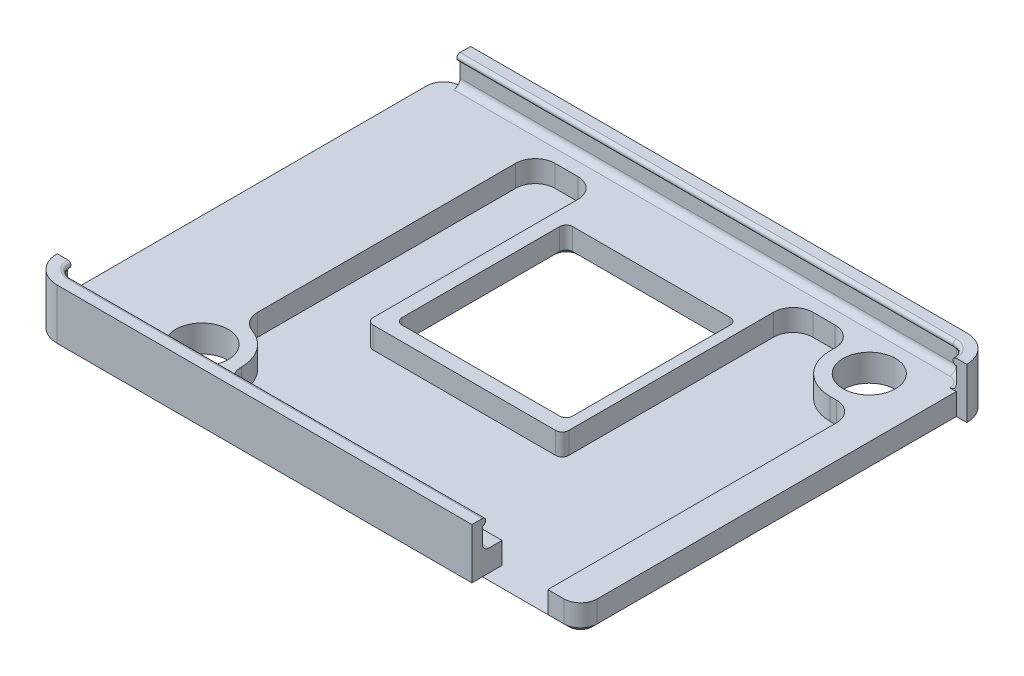
from build123d import *

# Parameters (mm, degrees)
CROQUIS1_W              = 40.35
CROQUIS1_H              = 29.9
CROQUIS1_R              = 2
SALIENTE_EXTRUIR1_DEPTH = 2.05
CORTAR_EXTRUIR2_DEPTH   = 1.65
CROQUIS3_W              = 13
CROQUIS3_H              = 13
CORTAR_EXTRUIR3_DEPTH   = 47.737063506
REDONDEO2_R             = 0.5
CHAFL_N1_SIZE           = 0.4
REDONDEO4_R             = 1.27
SALIENTE_EXTRUIR3_START = -2.05
SALIENTE_EXTRUIR3_DEPTH = 4.25
SALIENTE_EXTRUIR4_DEPTH = 1.65
CROQUIS9_R              = 0.25
CROQUIS11_R             = 0.25
REDONDEO6_R             = 1.5
REDONDEO7_R             = 0.5
REDONDEO8_R             = 0.5
CHAFL_N2_SIZE           = 0.4


# Some blends are built 0.0001 mm under size
with BuildPart() as part:
    # Croquis1 → Saliente-Extruir1 (new body)
    with BuildSketch(Plane(origin=(0, 0, 0), x_dir=(1, 0, 0), z_dir=(0, 1, 0))):
        with Locations((14.905897563, 15.863653327)):
            Rectangle(CROQUIS1_W, CROQUIS1_H)
        with Locations(Location((3.230897563, 3.913653327, 0), (0, 0, 270))):
            Circle(CROQUIS1_R, mode=Mode.SUBTRACT)
        with Locations(Location((30.580897563, 27.413653327, 0), (0, 0, 270))):
            Circle(CROQUIS1_R, mode=Mode.SUBTRACT)
    extrude(amount=SALIENTE_EXTRUIR1_DEPTH)

    # Croquis2 → Cortar-Extruir2 (cut)
    with BuildSketch(Plane(origin=(0, 2.05, 0), x_dir=(1, 0, 0), z_dir=(0, 1, 0))):
        with BuildLine():
            Line((27.580897563, 27.413653327), (27.580897563, 29.313653327))
            Line((27.580897563, 29.313653327), (22.880897563, 29.313653327))
            Line((22.880897563, 29.313653327), (22.880897563, 26.613653327))
            Line((22.880897563, 26.613653327), (22.880897563, 11.713653327))
            Line((22.880897563, 11.713653327), (7.980897563, 11.713653327))
            Line((7.980897563, 11.713653327), (7.980897563, 26.613653327))
            Line((7.980897563, 26.613653327), (7.980897563, 29.313653327))
            Line((7.980897563, 29.313653327), (3.230897563, 29.313653327))
            Line((3.230897563, 29.313653327), (3.230897563, 2.413653327))
            Line((3.230897563, 2.413653327), (27.6, 2.413653327))
            Line((27.6, 2.413653327), (27.6, 0.913653327))
            Line((27.6, 0.913653327), (32.580897563, 0.913653327))
            Line((32.580897563, 0.913653327), (32.580897563, 24.413653327))
            Line((32.580897563, 24.413653327), (30.580897563, 24.413653327))
            ThreePointArc((30.580897563, 24.413653327), (28.459577219, 25.292332983), (27.580897563, 27.413653327))
        make_face()
    extrude(amount=-CORTAR_EXTRUIR2_DEPTH, mode=Mode.SUBTRACT)

    # Croquis3 → Cortar-Extruir3 (cut, through all)
    with BuildSketch(Plane(origin=(0, 2.05, 0), x_dir=(1, 0, 0), z_dir=(0, 1, 0))):
        with Locations((15.580897563, 19.313653327)):
            Rectangle(CROQUIS3_W, CROQUIS3_H)
    extrude(amount=-CORTAR_EXTRUIR3_DEPTH, mode=Mode.SUBTRACT)

    # Redondeo2
    redondeo2_edges = [part.edges().sort_by_distance(p)[0] for p in [
        (9.080897563, 1.025, -12.813653327),
        (9.080897563, 1.025, -25.813653327),
        (22.080897563, 1.025, -25.813653327),
        (22.080897563, 1.025, -12.813653327),
    ]]
    fillet(redondeo2_edges, radius=REDONDEO2_R)

    # Chaflán1
    chafl_n1_edges = [part.edges().sort_by_distance(p)[0] for p in [
        (15.580897563, 0, -25.813653327),
        (22.080897563, 0, -19.313653327),
        (15.580897563, 0, -12.813653327),
        (9.080897563, 0, -19.313653327),
        (21.934450953, 0, -25.667206717),
        (21.934450953, 0, -12.960099936),
        (9.227344172, 0, -12.960099936),
        (9.227344172, 0, -25.667206717),
    ]]
    chamfer(chafl_n1_edges, length=CHAFL_N1_SIZE)

    # Redondeo4
    redondeo4_edges = [part.edges().sort_by_distance(p)[0] for p in [
        (-5.269102437, 1.025, -30.813653327),
        (35.080897563, 1.025, -30.813653327),
        (35.080897563, 1.025, -0.913653327),
        (-5.269102437, 1.025, -0.913653327),
    ]]
    fillet(redondeo4_edges, radius=REDONDEO4_R)

    # Croquis6 → Saliente-Extruir3 (add)
    with BuildSketch(Plane(origin=(0, 2.05, 0), x_dir=(1, 0, 0), z_dir=(0, 1, 0)).offset(SALIENTE_EXTRUIR3_START)):
        with BuildLine():
            Line((-3.999102437, 30.813653327), (33.810897563, 30.813653327))
            ThreePointArc((33.810897563, 30.813653327), (34.708923175, 30.441678939), (35.080897563, 29.543653327))
            Line((35.080897563, 29.543653327), (35.880897563, 29.543653327))
            ThreePointArc((35.880897563, 29.543653327), (35.2746086, 31.007364364), (33.810897563, 31.613653327))
            Line((33.810897563, 31.613653327), (-3.999102437, 31.613653327))
            Line((-3.999102437, 31.613653327), (-3.999102437, 30.813653327))
        make_face()
        with BuildLine():
            Line((27.6, 0.913653327), (-3.999102437, 0.913653327))
            ThreePointArc((-3.999102437, 0.913653327), (-4.89712805, 1.285627715), (-5.269102437, 2.183653327))
            Line((-5.269102437, 2.183653327), (-6.069102437, 2.183653327))
            ThreePointArc((-6.069102437, 2.183653327), (-5.462813475, 0.71994229), (-3.999102437, 0.113653327))
            Line((-3.999102437, 0.113653327), (27.6, 0.113653327))
            Line((27.6, 0.113653327), (27.6, 0.913653327))
        make_face()
    extrude(amount=SALIENTE_EXTRUIR3_DEPTH)

    # Croquis7 → Saliente-Extruir4 (add)
    with BuildSketch(Plane(origin=(0, 0.4, 0), x_dir=(1, 0, 0), z_dir=(0, 1, 0))):
        with BuildLine():
            ThreePointArc((6.230897563, 3.913653327), (5.352217906, 6.03497367), (3.230897563, 6.913653327))
            Line((3.230897563, 6.913653327), (3.230897563, 5.913653327))
            ThreePointArc((3.230897563, 5.913653327), (5.101726256, 4.620760108), (4.553773218, 2.413653327))
            Line((4.553773218, 2.413653327), (6.230897563, 2.413653327))
            Line((6.230897563, 2.413653327), (6.230897563, 3.913653327))
        make_face()
    extrude(amount=SALIENTE_EXTRUIR4_DEPTH)

    # Barrer1: sweep along a path in Croquis10
    with BuildLine(Plane(origin=(0, 4.25, 0), x_dir=(1, 0, 0), z_dir=(0, 1, 0))) as barrer1_path:
        Line((-3.999102437, 30.813653327), (33.810897563, 30.813653327))
        ThreePointArc((33.810897563, 30.813653327), (34.708923175, 30.441678939), (35.080897563, 29.543653327))
    # Croquis9 → Barrer1 (sweep)
    with BuildSketch(Plane.XY.offset(-29.543653327)):
        with Locations((35.080897563, 4)):
            Circle(CROQUIS9_R)
    sweep(path=barrer1_path.line)

    # Barrer2: sweep along a path in Croquis12
    with BuildLine(Plane(origin=(0, 4.25, 0), x_dir=(1, 0, 0), z_dir=(0, 1, 0))) as barrer2_path:
        Line((27.6, 0.913653327), (-3.999102437, 0.913653327))
        ThreePointArc((-3.999102437, 0.913653327), (-4.89712805, 1.285627715), (-5.269102437, 2.183653327))
    # Croquis11 → Barrer2 (sweep)
    with BuildSketch(Plane(origin=(0, 0, -2.183653327), x_dir=(-1, 0, 0), z_dir=(0, 0, -1))):
        with Locations((5.269102437, 4)):
            Circle(CROQUIS11_R)
    sweep(path=barrer2_path.line)

    # Redondeo6
    redondeo6_edges = [part.edges().sort_by_distance(p)[0] for p in [
        (3.230897563, 1.225, -6.913653327),
        (6.230897563, 1.225, -2.413653327),
        (3.230897563, 1.225, -29.313653327),
        (7.980897563, 1.225, -29.313653327),
        (22.880897563, 1.225, -29.313653327),
        (27.580897563, 1.225, -29.313653327),
        (32.580897563, 1.225, -24.413653327),
    ]]
    fillet(redondeo6_edges, radius=REDONDEO6_R - 0.0001)  # a hair under: the kernel refuses the full size

    # Redondeo7
    redondeo7_edges = [part.edges().sort_by_distance(p)[0] for p in [
        (7.980897563, 1.225, -11.713653327),
        (22.880897563, 1.225, -11.713653327),
    ]]
    fillet(redondeo7_edges, radius=REDONDEO7_R)

    # Redondeo8
    # the kernel refuses this fillet: 0.5 mm, written as the material it adds along each edge
    with BuildSketch(Plane(origin=(33.810897563, 2.05, -30.813653327), x_dir=(0, 0, 1), z_dir=(-1, 0, 0))) as redondeo8_piece_1:
        with BuildLine():
            CenterArc((REDONDEO8_R, REDONDEO8_R), REDONDEO8_R, 180, 90)
            Line((0, REDONDEO8_R), (0, 0))
            Line((0, 0), (REDONDEO8_R, 0))
        make_face()
    extrude(amount=37.81)
    with BuildSketch(Plane(origin=(-3.999102437, 2.05, -0.913653327), x_dir=(0, 0, -1), z_dir=(1, 0, 0))) as redondeo8_piece_2:
        with BuildLine():
            CenterArc((REDONDEO8_R, REDONDEO8_R), REDONDEO8_R, 180, 90)
            Line((0, REDONDEO8_R), (0, 0))
            Line((0, 0), (REDONDEO8_R, 0))
        make_face()
    extrude(amount=31.599102437)
    with BuildSketch(Plane(origin=(33.810897563, 2.05, -29.543653327), x_dir=(1, 0, 0), z_dir=(0, 0, 1))) as redondeo8_piece_3:
        with BuildLine():
            CenterArc((1.27 - REDONDEO8_R, REDONDEO8_R), REDONDEO8_R, 270, 90)
            Line((1.27, REDONDEO8_R), (1.27, 0))
            Line((1.27, 0), (1.27 - REDONDEO8_R, 0))
        make_face()
    revolve(axis=Axis((33.810897563, 2.05, -29.543653327), (0, 1, 0)), revolution_arc=90)
    with BuildSketch(Plane(origin=(-3.999102437, 2.05, -2.183653327), x_dir=(0, 0, 1), z_dir=(1, 0, 0))) as redondeo8_piece_4:
        with BuildLine():
            CenterArc((1.27 - REDONDEO8_R, -REDONDEO8_R), REDONDEO8_R, 0, 90)
            Line((1.27, -REDONDEO8_R), (1.27, 0))
            Line((1.27, 0), (1.27 - REDONDEO8_R, 0))
        make_face()
    revolve(axis=Axis((-3.999102437, 2.05, -2.183653327), (0, -1, 0)), revolution_arc=90)

    # Chaflán2
    chafl_n2_edges = [part.edges().sort_by_distance(p)[0] for p in [
        (-5.269102437, 0, -15.863653327),
        (-5.669102437, 0, -2.183653327),
        (-5.462813475, 0, -0.71994229),
        (11.800448781, 0, -0.113653327),
        (27.6, 0, -0.513653327),
        (30.705448781, 0, -0.913653327),
        (34.708923175, 0, -1.285627715),
        (35.080897563, 0, -15.863653327),
        (35.480897563, 0, -29.543653327),
        (35.2746086, 0, -31.007364364),
        (14.905897563, 0, -31.613653327),
        (-3.999102437, 0, -31.213653327),
        (-4.89712805, 0, -30.441678939),
    ]]
    chamfer(chafl_n2_edges, length=CHAFL_N2_SIZE - 0.0001)  # a hair under: the kernel refuses the full size


solid = part.part
